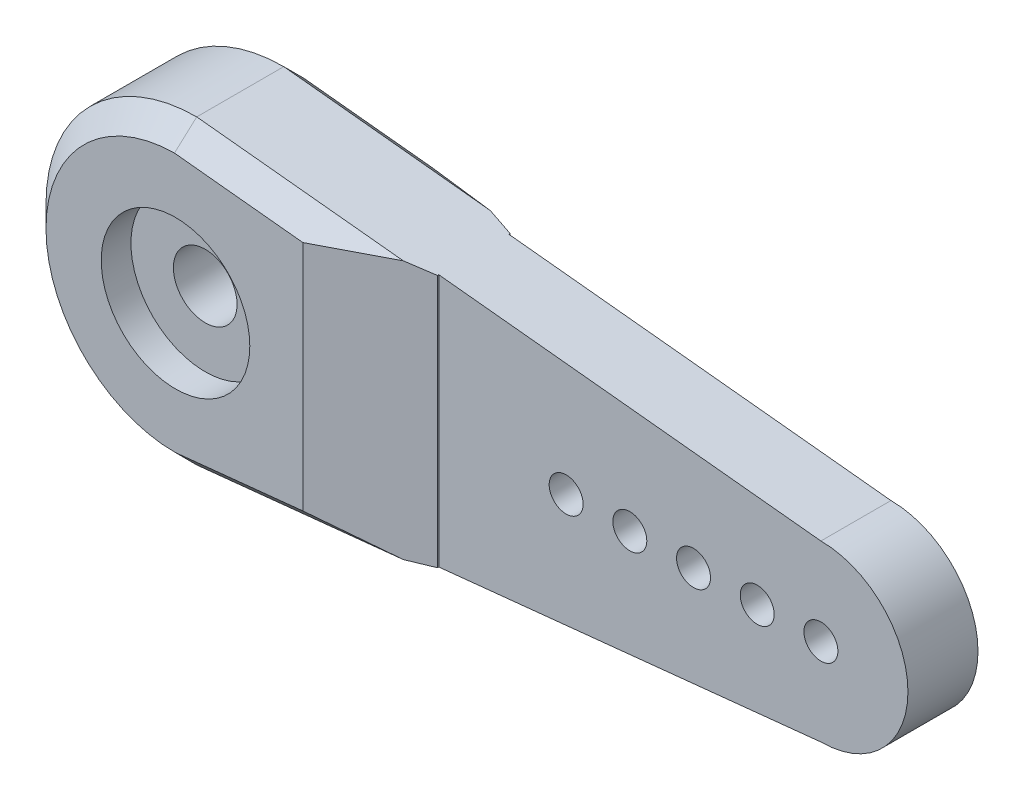
from build123d import *
from OCP.BRepFilletAPI import BRepFilletAPI_MakeChamfer

# Parameters (mm, degrees)
ESQUISSE1_R             = 0.8
ESQUISSE1_R_2           = 1.5
BOSS_EXTRU_1_DEPTH      = 3.3
BOSS_EXTRU_2_DEPTH      = 1.4
BOSS_EXTRU_2_DEPTH_BACK = 4.7
ESQUISSE2_R             = 3.5
CHANFREIN1_SIZE         = 5
CHANFREIN1_SIZE2        = 1.339745962
CHANFREIN3_SIZE         = 1


with BuildPart() as part:
    # Esquisse1 → Boss.-Extru.1 (new body)
    with BuildSketch(Plane.XY):
        with BuildLine():
            Line((0, -7.1), (29, -4.1))
            ThreePointArc((29, -4.1), (33.1, 0), (29, 4.1))
            Line((29, 4.1), (0, 7.1))
            ThreePointArc((0, 7.1), (-7.1, 0), (0, -7.1))
        make_face()
        with Locations((29, 0)):
            Circle(ESQUISSE1_R, mode=Mode.SUBTRACT)
        with Locations((26, 0)):
            Circle(ESQUISSE1_R, mode=Mode.SUBTRACT)
        with Locations((23, 0)):
            Circle(ESQUISSE1_R, mode=Mode.SUBTRACT)
        with Locations((20, 0)):
            Circle(ESQUISSE1_R, mode=Mode.SUBTRACT)
        with Locations((17, 0)):
            Circle(ESQUISSE1_R, mode=Mode.SUBTRACT)
        Circle(ESQUISSE1_R_2, mode=Mode.SUBTRACT)
    extrude(amount=BOSS_EXTRU_1_DEPTH)

    # Esquisse2 → Boss.-Extru.2 (add, two sides: drawn at the far end of the back side and taken through both)
    with BuildSketch(Plane.XY.offset(3.3).offset(-BOSS_EXTRU_2_DEPTH_BACK)):
        with BuildLine():
            Line((0, -7.1), (11, -5.962068966))
            Line((11, -5.962068966), (11, 5.962068966))
            Line((11, 5.962068966), (0, 7.1))
            ThreePointArc((0, 7.1), (-7.1, 0), (0, -7.1))
        make_face()
        Circle(ESQUISSE2_R, mode=Mode.SUBTRACT)
    extrude(amount=BOSS_EXTRU_2_DEPTH + BOSS_EXTRU_2_DEPTH_BACK)

    # Chanfrein1: one chamfer whose edges measure the first distance from different faces: ONE call of the kernel's chamfer builder (chamfer() names one face for all edges)
    chanfrein1_edges_1 = [part.edges().sort_by_distance(p)[0] for p in [
        (11, 0, -1.4),
    ]]
    chanfrein1_side_1 = [part.faces().sort_by_distance(p)[0] for p in [
        (5.476327604, -6.302201317, -1.4),
    ]]
    chanfrein1_edges_2 = [part.edges().sort_by_distance(p)[0] for p in [
        (11, 0, 4.7),
    ]]
    chanfrein1_side_2 = [part.faces().sort_by_distance(p)[0] for p in [
        (5.476327604, -6.302201317, 4.7),
    ]]
    chanfrein1 = BRepFilletAPI_MakeChamfer(part.part.solid().wrapped)
    for e in chanfrein1_edges_1:
        chanfrein1.Add(CHANFREIN1_SIZE, CHANFREIN1_SIZE2, e.wrapped, chanfrein1_side_1[0].wrapped)  # the first distance lies on this face
    for e in chanfrein1_edges_2:
        chanfrein1.Add(CHANFREIN1_SIZE, CHANFREIN1_SIZE2, e.wrapped, chanfrein1_side_2[0].wrapped)  # the first distance lies on this face
    add(Compound.cast(chanfrein1.Shape()), mode=Mode.REPLACE)

    # Chanfrein3
    chanfrein3_edges = [part.edges().sort_by_distance(p)[0] for p in [
        (3, -6.789655172, 4.7),
    ]]
    chamfer(chanfrein3_edges, length=CHANFREIN3_SIZE)
    chanfrein3_2_edges = [part.edges().sort_by_distance(p)[0] for p in [
        (3, -6.789655172, -1.4),
    ]]
    chamfer(chanfrein3_2_edges, length=CHANFREIN3_SIZE)
    chanfrein3_3_edges = [part.edges().sort_by_distance(p)[0] for p in [
        (3, 6.789655172, 4.7),
    ]]
    chamfer(chanfrein3_3_edges, length=CHANFREIN3_SIZE)
    chanfrein3_4_edges = [part.edges().sort_by_distance(p)[0] for p in [
        (3, 6.789655172, -1.4),
    ]]
    chamfer(chanfrein3_4_edges, length=CHANFREIN3_SIZE)
    chanfrein3_5_edges = [part.edges().sort_by_distance(p)[0] for p in [
        (-7.1, 0, 4.7),
    ]]
    chamfer(chanfrein3_5_edges, length=CHANFREIN3_SIZE)
    chanfrein3_6_edges = [part.edges().sort_by_distance(p)[0] for p in [
        (-7.1, 0, -1.4),
    ]]
    chamfer(chanfrein3_6_edges, length=CHANFREIN3_SIZE)


solid = part.part
